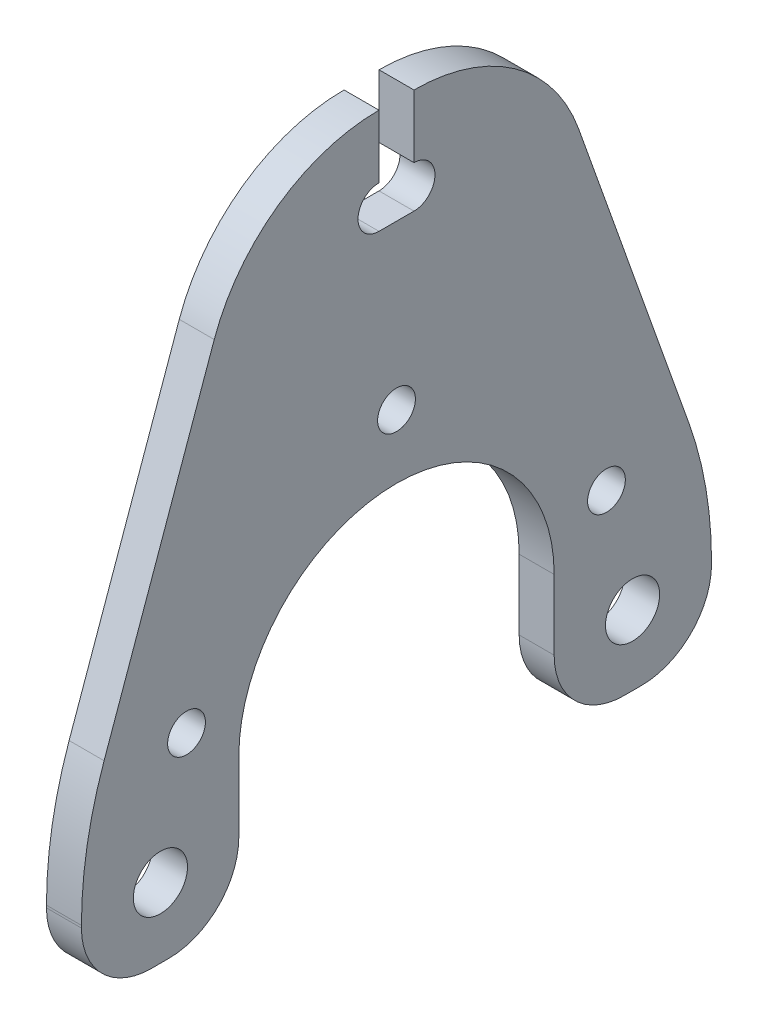
from build123d import *

# Parameters (mm, degrees)
BOSS_EXTRUDE1_DEPTH              = 3.175
F_10_0_1935_DIAMETER_HOLE1_D     = 4.9149
F_10_0_1935_DIAMETER_HOLE1_DEPTH = 19.001994
F_10_0_1935_DIAMETER_HOLE1_TIP   = 1.476584928
SKETCH4_R                        = 1.7145
CUT_EXTRUDE1_DEPTH               = 53.951543936
FILLET2_R                        = 35.56
FILLET1_R                        = 6.35
CUT_EXTRUDE3_DEPTH               = 53.951543936


with BuildPart() as part:
    # Sketch1 → Boss-Extrude1 (new body)
    with BuildSketch(Plane(origin=(0, 0, 0), x_dir=(0, 0, -1), z_dir=(1, 0, 0))):
        with BuildLine():
            Line((1.5875, 44.45), (1.5875, 34.925))
            Line((1.5875, 34.925), (-1.5875, 34.925))
            Line((-1.5875, 34.925), (-1.5875, 44.45))
            ThreePointArc((-1.5875, 44.45), (-10.740674928, 41.545544081), (-16.544559386, 33.894962362))
            Line((-16.544559386, 33.894962362), (-28.6004, 0))
            Line((-28.6004, 0), (-28.6004, -12.7))
            Line((-28.6004, -12.7), (-14.3129, -12.7))
            Line((-14.3129, -12.7), (-14.3129, 0))
            ThreePointArc((-14.3129, 0), (0, 14.3129), (14.3129, 0))
            Line((14.3129, 0), (14.3129, -12.7))
            Line((14.3129, -12.7), (28.6004, -12.7))
            Line((28.6004, -12.7), (28.6004, 0))
            Line((28.6004, 0), (16.544559386, 33.894962362))
            ThreePointArc((16.544559386, 33.894962362), (10.740674928, 41.545544081), (1.5875, 44.45))
        make_face()
    extrude(amount=BOSS_EXTRUDE1_DEPTH)

    # #10 (0.1935) Diameter Hole1
    with Locations(Plane.ZY):
        with Locations((-21.43125, -6.35), (21.43125, -6.35)):
            Hole(F_10_0_1935_DIAMETER_HOLE1_D / 2, depth=F_10_0_1935_DIAMETER_HOLE1_DEPTH)
            with Locations((0, 0, -(F_10_0_1935_DIAMETER_HOLE1_DEPTH + F_10_0_1935_DIAMETER_HOLE1_TIP / 2))):  # 118° drill point
                Cone(0, F_10_0_1935_DIAMETER_HOLE1_D / 2, F_10_0_1935_DIAMETER_HOLE1_TIP, mode=Mode.SUBTRACT)

    # Sketch4 → Cut-Extrude1 (cut, through all)
    with BuildSketch(Plane(origin=(3.175, 0, 0), x_dir=(0, 0, -1), z_dir=(1, 0, 0))):
        with Locations((0, 20.09775)):
            Circle(SKETCH4_R)
        with Locations((-19.061573026, 4.22275)):
            Circle(SKETCH4_R)
        with Locations((19.061573026, 4.22275)):
            Circle(SKETCH4_R)
    extrude(amount=-CUT_EXTRUDE1_DEPTH, mode=Mode.SUBTRACT)

    # Fillet2
    fillet2_edges = [part.edges().sort_by_distance(p)[0] for p in [
        (1.5875, 0, 28.6004),
        (1.5875, 0, -28.6004),
    ]]
    fillet(fillet2_edges, radius=FILLET2_R)

    # Fillet1
    fillet1_edges = [part.edges().sort_by_distance(p)[0] for p in [
        (1.5875, -12.7, -28.6004),
        (1.5875, -12.7, -14.3129),
        (1.5875, -12.7, 28.6004),
        (1.5875, -12.7, 14.3129),
    ]]
    fillet(fillet1_edges, radius=FILLET1_R)

    # Sketch6 → Cut-Extrude3 (cut, through all)
    with BuildSketch(Plane(origin=(3.175, 0, 0), x_dir=(0, 0, -1), z_dir=(1, 0, 0))):
        with BuildLine():
            Line((-1.5875, 38.735), (1.5875, 38.735))
            ThreePointArc((1.5875, 38.735), (3.4925, 36.83), (1.5875, 34.925))
            Line((1.5875, 34.925), (-1.5875, 34.925))
            ThreePointArc((-1.5875, 34.925), (-3.4925, 36.83), (-1.5875, 38.735))
        make_face()
    extrude(amount=-CUT_EXTRUDE3_DEPTH, mode=Mode.SUBTRACT)


solid = part.part
